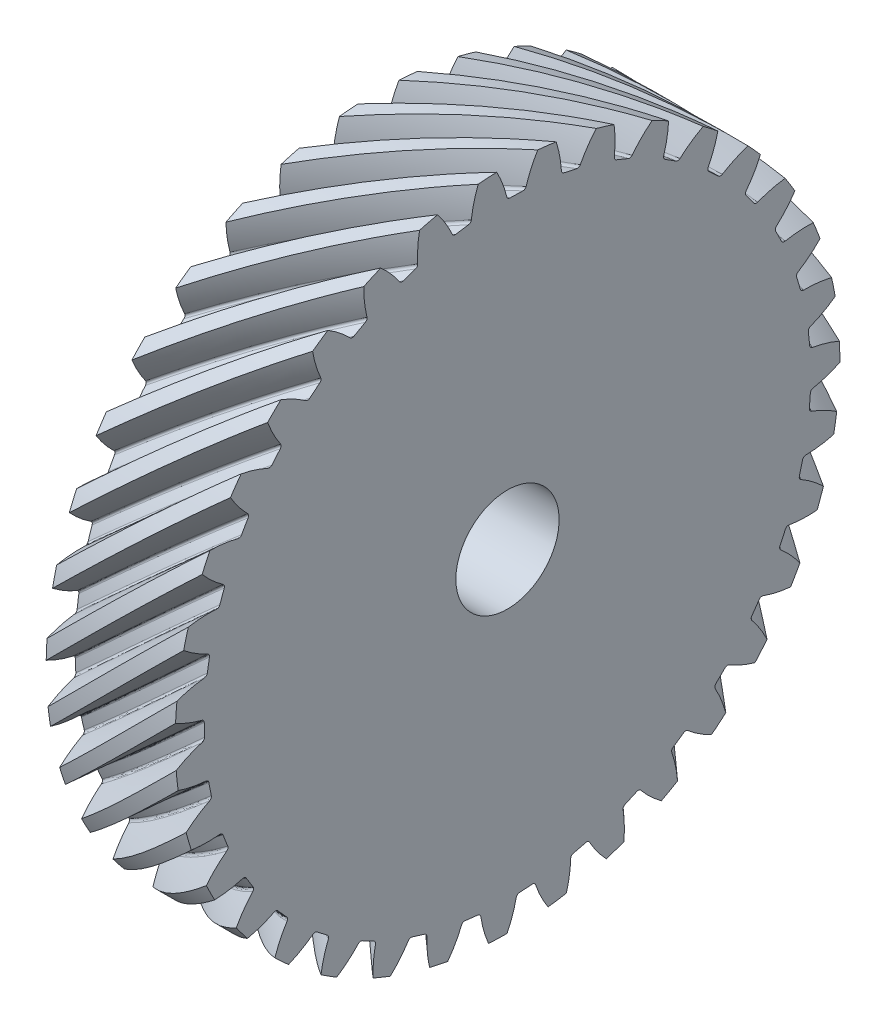
from build123d import *

# Parameters (mm, degrees)
BASPROSKE_W            = 25
BASPROSKE_H            = 64.371843354
TOOTHCUTLH_PITCH       = 404.460220357
TOOTHCUTLH_HEIGHT      = 25
TOOTHCUTLH_RADIUS      = 64.371843354
TOOTHCUTLH_START_ANGLE = -90
TEETHCUTSLH_COUNT      = 35
TEETHCUTSLH_ANGLE      = 349.714285714
BORSKE_R               = 10
BORE_DEPTH             = 62.5000025


with BuildPart() as part:
    # BasProSke → Base-Revolve (revolve)
    with BuildSketch(Plane(origin=(0, 0, 0), x_dir=(1, 0, 0), z_dir=(0, 1, 0)), mode=Mode.PRIVATE) as base_revolve_sk:
        with Locations((12.5, 32.185921677)):
            Rectangle(BASPROSKE_W, BASPROSKE_H)
    revolve(base_revolve_sk.sketch.rotate(Axis((-10, 0, 0), (1, 0, 0)), 180), axis=Axis((-10, 0, 0), (1, 0, 0)))

    # ToothCutLH: sweep along a helix
    with BuildLine() as toothcutlh_path:
        add(Helix(TOOTHCUTLH_PITCH, TOOTHCUTLH_HEIGHT, TOOTHCUTLH_RADIUS, center=(0, 0, 0), direction=(1, 0, 0), lefthand=True, mode=Mode.PRIVATE).rotate(Axis((0, 0, 0), (1, 0, 0)), TOOTHCUTLH_START_ANGLE))
    # TooCutSkeRH<3> → ToothCutLH (sweep, cut)
    with BuildSketch(Plane(origin=(0, 0, 0), x_dir=(0, 0, -1), z_dir=(1, 0, 0))):
        with BuildLine():
            ThreePointArc((1.25498296, 58.733437), (0, 58.746843354), (-1.25498296, 58.733437))
            ThreePointArc((-1.25498296, 58.733437), (-1.642304292, 58.857259665), (-1.87184022, 59.192912946))
            ThreePointArc((-1.87184022, 59.192912946), (-3.214115288, 62.792358903), (-5.165367004, 66.101487232))
            ThreePointArc((-5.165367004, 66.101487232), (0, 66.302998654), (5.165367004, 66.101487232))
            ThreePointArc((5.165367004, 66.101487232), (3.214115288, 62.792358903), (1.87184022, 59.192912946))
            ThreePointArc((1.87184022, 59.192912946), (1.642304292, 58.857259665), (1.25498296, 58.733437))
        make_face()
    toothcutlh = sweep(path=toothcutlh_path.line, is_frenet=True, mode=Mode.SUBTRACT)

    # TeethCutsLH: ToothCutLH ×35 about axis
    teethcutslh_axis = Axis((-10, 0, 0), (1, 0, 0))
    for i in range(1, TEETHCUTSLH_COUNT):
        add(toothcutlh.rotate(teethcutslh_axis, i * TEETHCUTSLH_ANGLE / (TEETHCUTSLH_COUNT - 1)), mode=Mode.SUBTRACT)

    # BorSke → Bore (cut, symmetric)
    with BuildSketch(Plane(origin=(0, 0, 0), x_dir=(0, 0, -1), z_dir=(1, 0, 0))):
        with Locations(Location((0, 0, 0), (0, 0, 180))):
            Circle(BORSKE_R)
    extrude(amount=BORE_DEPTH, both=True, mode=Mode.SUBTRACT)


solid = part.part
